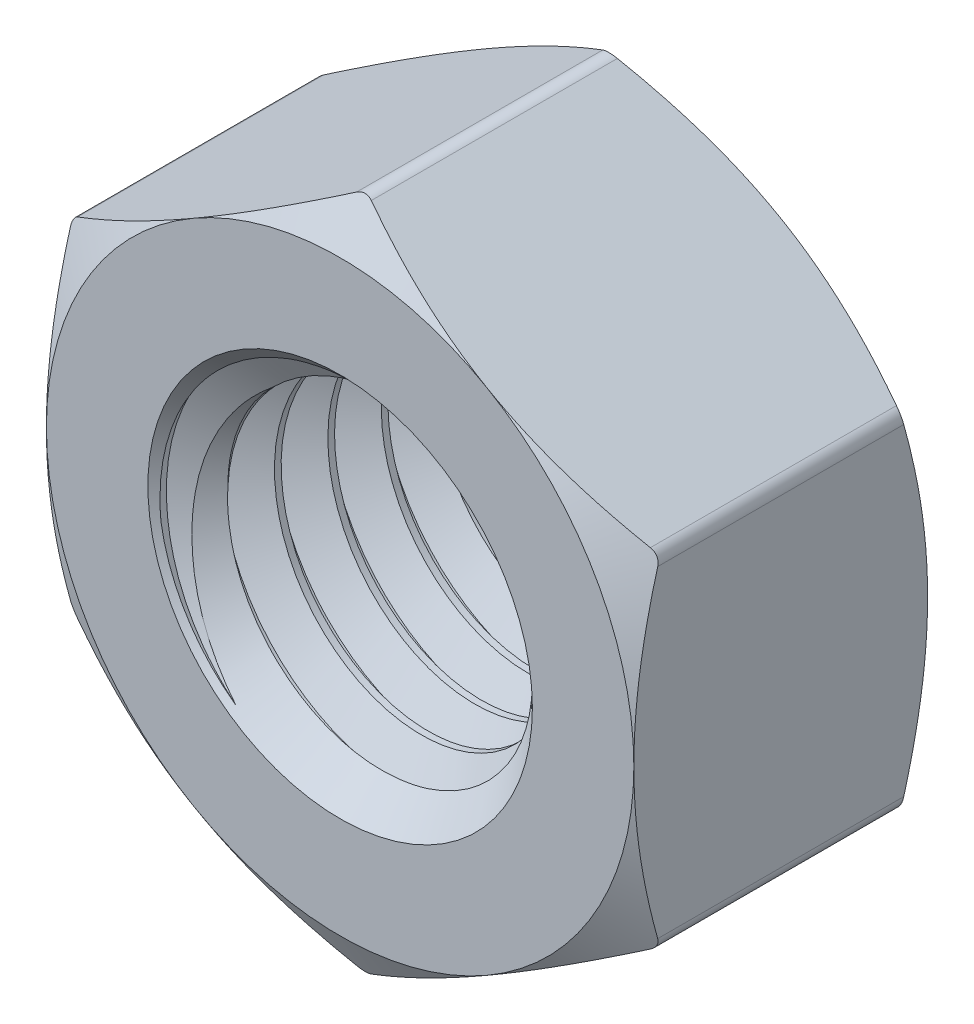
from build123d import *

# Parameters (mm, degrees)
BOSS_EXTRUDE2_DEPTH     = 2.75
CUT_EXTRUDE4_DEPTH      = 9.840013198
CUT_EXTRUDE4_DEPTH_BACK = 9.840013198
SKETCH16_R              = 3.5
SKETCH7_OUTSIDE_W       = 54.786
SKETCH7_OUTSIDE_H       = 56.488
SKETCH7_OUTSIDE_R       = 5.5
CUT_EXTRUDE5_DEPTH      = 11.041580221
CUT_EXTRUDE5_DRAFT      = -60
MIRROR4_COPY_1_SKETCH_W = 54.786
MIRROR4_COPY_1_SKETCH_H = 56.488
MIRROR4_COPY_1_SKETCH_R = 5.5
MIRROR4_COPY_1_DEPTH    = 11.041580221
MIRROR4_COPY_1_DRAFT    = -60
FILLET2_R               = 0.275
SKETCH13_R              = 3.5
BOSS_EXTRUDE1_DEPTH     = 5.5
CUT_SWEEP1_PITCH        = 1
SKETCH17_R              = 3.5
BOSS_EXTRUDE3_DEPTH     = 5.5


with BuildPart() as part:
    # Sketch15 → Boss-Extrude2 (new, symmetric)
    with BuildSketch(Plane.XY):
        Polygon((0, 6.350852961), (-5.5, 3.175426481), (-5.5, -3.175426481), (0, -6.350852961), (5.5, -3.175426481), (5.5, 3.175426481), align=None)
    extrude(amount=BOSS_EXTRUDE2_DEPTH, both=True)

    # Sketch16 → Cut-Extrude4 (cut, two sides: drawn at the far end of the back side and taken through both)
    with BuildSketch(Plane.XY.offset(-CUT_EXTRUDE4_DEPTH_BACK)):
        Circle(SKETCH16_R)
    extrude(amount=CUT_EXTRUDE4_DEPTH + CUT_EXTRUDE4_DEPTH_BACK, mode=Mode.SUBTRACT)


with BuildPart() as cut_extrude5_tool:
    # Sketch7 outside → Cut-Extrude5 (with draft: the straight prism first)
    with BuildSketch(Plane.XY.offset(2.75)):
        Rectangle(SKETCH7_OUTSIDE_W, SKETCH7_OUTSIDE_H)
        Circle(SKETCH7_OUTSIDE_R, mode=Mode.SUBTRACT)
    extrude(amount=-CUT_EXTRUDE5_DEPTH)
    # Cut-Extrude5: the draft: its side faces are tilted about the plane it starts from
    cut_extrude5_sides = [cut_extrude5_tool.faces().sort_by_distance(p)[0] for p in [
        (0, -28.244, -2.77079011),
        (27.393, 0, -2.77079011),
        (0, 28.244, -2.77079011),
        (-27.393, 0, -2.77079011),
        (-5.5, 0, -2.77079011),
    ]]
    draft(cut_extrude5_sides, Plane.XY.offset(2.75), CUT_EXTRUDE5_DRAFT)


with BuildPart() as part_1:
    add(part.part)

    # Cut-Extrude5: cut by cut_extrude5_tool
    add(cut_extrude5_tool.part, mode=Mode.SUBTRACT)


with BuildPart() as mirror4_copy_1_tool:
    # Mirror4 copy 1 sketch → Mirror4 copy 1 (with draft: the straight prism first)
    with BuildSketch(Plane(origin=(0, 0, -2.75), x_dir=(1, 0, 0), z_dir=(0, 0, -1))):
        Rectangle(MIRROR4_COPY_1_SKETCH_W, MIRROR4_COPY_1_SKETCH_H)
        Circle(MIRROR4_COPY_1_SKETCH_R, mode=Mode.SUBTRACT)
    extrude(amount=-MIRROR4_COPY_1_DEPTH)
    # Mirror4 copy 1: the draft: its side faces are tilted about the plane it starts from
    mirror4_copy_1_sides = [mirror4_copy_1_tool.faces().sort_by_distance(p)[0] for p in [
        (0, -28.244, 2.77079011),
        (27.393, 0, 2.77079011),
        (0, 28.244, 2.77079011),
        (-27.393, 0, 2.77079011),
        (-5.5, 0, 2.77079011),
    ]]
    draft(mirror4_copy_1_sides, Plane(origin=(0, 0, -2.75), x_dir=(1, 0, 0), z_dir=(0, 0, -1)), MIRROR4_COPY_1_DRAFT)


with BuildPart() as part_2:
    add(part_1.part)

    # Mirror4 copy 1: cut by mirror4_copy_1_tool
    add(mirror4_copy_1_tool.part, mode=Mode.SUBTRACT)

    # Fillet2
    fillet2_edges = [part_2.edges().sort_by_distance(p)[0] for p in [
        (-5.5, 3.175426481, 0),
        (-5.5, -3.175426481, 0),
        (0, -6.350852961, 0),
        (5.5, -3.175426481, 0),
        (5.5, 3.175426481, 0),
        (0, 6.350852961, 0),
    ]]
    fillet(fillet2_edges, radius=FILLET2_R)

    # Sketch17 → Boss-Extrude3 (add)
    with BuildSketch(Plane.XY.offset(2.75)):
        Circle(SKETCH17_R)
    extrude(amount=-BOSS_EXTRUDE3_DEPTH)


with BuildPart() as body_2:
    # Sketch13 → Boss-Extrude1 (new body)
    with BuildSketch(Plane(origin=(0, 0, -2.75), x_dir=(-1, 0, 0), z_dir=(0, 0, -1))):
        Circle(SKETCH13_R)
    extrude(amount=-BOSS_EXTRUDE1_DEPTH)

    # Cut-Sweep1: the profile of Sketch12 profile screwed along a right-hand helix of 7.5 turns, 8 arcs to a turn; built about Z, then put on its axis
    cut_sweep1_z = Axis((0, 0, 0), (0, 0, 1))
    cut_sweep1_corners = [(3.5003, 0, -0.875173205), (3.5003, 0, 0.000173205), (2.850480947, 0, -0.375), (2.850480947, 0, -0.5)]
    with BuildLine(mode=Mode.PRIVATE) as cut_sweep1_profile:
        Line(cut_sweep1_corners[0], cut_sweep1_corners[1])
        Line(cut_sweep1_corners[1], cut_sweep1_corners[2])
        Line(cut_sweep1_corners[2], cut_sweep1_corners[3])
        Line(cut_sweep1_corners[3], cut_sweep1_corners[0])
    cut_sweep1_cap = Face(cut_sweep1_profile.wire())
    cut_sweep1_turn_angles = [0, 22.5, 45, 67.5, 90, 112.5, 135, 157.5, 180, 202.5, 225, 247.5, 270, 292.5, 315, 337.5, 360]
    cut_sweep1_turn_weights = [1, 0.9238795325112867, 1, 0.9238795325112867, 1, 0.9238795325112867, 1, 0.9238795325112867, 1, 0.9238795325112867, 1, 0.9238795325112867, 1, 0.9238795325112867, 1, 0.9238795325112867, 1]
    cut_sweep1_turn_rails = [Edge.make_bspline([Vector(p[0], p[1], 0).rotate(cut_sweep1_z, cut_sweep1_turn_angles[k]) / cut_sweep1_turn_weights[k] + Vector(0, 0, p[2] + CUT_SWEEP1_PITCH * cut_sweep1_turn_angles[k] / 360) for k in range(17)], [0, 0, 0, 1, 1, 2, 2, 3, 3, 4, 4, 5, 5, 6, 6, 7, 7, 8, 8, 8], 2, cut_sweep1_turn_weights) for p in cut_sweep1_corners]
    cut_sweep1_turn_sides = [Face.make_surface_from_curves(cut_sweep1_turn_rails[p[0]], cut_sweep1_turn_rails[p[1]]) for p in [(0, 1), (1, 2), (2, 3), (3, 0)]]
    cut_sweep1_last_angles = [2520, 2542.5, 2565, 2587.5, 2610, 2632.5, 2655, 2677.5, 2700]
    cut_sweep1_last_weights = [1, 0.9238795325112867, 1, 0.9238795325112867, 1, 0.9238795325112867, 1, 0.9238795325112898, 1]
    cut_sweep1_last_rails = [Edge.make_bspline([Vector(p[0], p[1], 0).rotate(cut_sweep1_z, cut_sweep1_last_angles[k]) / cut_sweep1_last_weights[k] + Vector(0, 0, p[2] + CUT_SWEEP1_PITCH * cut_sweep1_last_angles[k] / 360) for k in range(9)], [0, 0, 0, 1, 1, 2, 2, 3, 3, 4, 4, 4], 2, cut_sweep1_last_weights) for p in cut_sweep1_corners]
    cut_sweep1_last_sides = [Face.make_surface_from_curves(cut_sweep1_last_rails[p[0]], cut_sweep1_last_rails[p[1]]) for p in [(0, 1), (1, 2), (2, 3), (3, 0)]]
    cut_sweep1 = Plane(origin=(0, 0, -2.75), x_dir=(0, 1, 0), z_dir=(0, 0, 1)) * Solid(Shell([*[p.moved(Location((0, 0, CUT_SWEEP1_PITCH * i))) for i in range(7) for p in cut_sweep1_turn_sides], *cut_sweep1_last_sides, cut_sweep1_cap, cut_sweep1_cap.rotate(cut_sweep1_z, 2700).moved(Location((0, 0, CUT_SWEEP1_PITCH * 2700 / 360)))]))
    add(cut_sweep1, mode=Mode.SUBTRACT)


with BuildPart() as part_3:
    add(part_2.part)

    # Combine1: cut body 2
    add(body_2.part, mode=Mode.SUBTRACT)

    # Cut-Extrude2 cone 1 section (through the dimple's axis) → Cut-Extrude2 (revolve, cut)
    with BuildSketch(Plane(origin=(0, 0, 2.75), x_dir=(0, -1, 0), z_dir=(1, 0, 0))):
        Polygon((0, 0), (3.6, 0), (0, 3.6), align=None)
    revolve(axis=Axis((0, 0, 2.75), (0, 0, -1)), mode=Mode.SUBTRACT)

    # Cut-Extrude3 cone 1 section (through the dimple's axis) → Cut-Extrude3 (revolve, cut)
    with BuildSketch(Plane(origin=(0, 0, -2.75), x_dir=(0, 1, 0), z_dir=(1, 0, 0))):
        Polygon((0, 0), (3.6, 0), (0, 3.6), align=None)
    revolve(axis=Axis((0, 0, -2.75), (0, 0, 1)), mode=Mode.SUBTRACT)


solid = part_3.part
